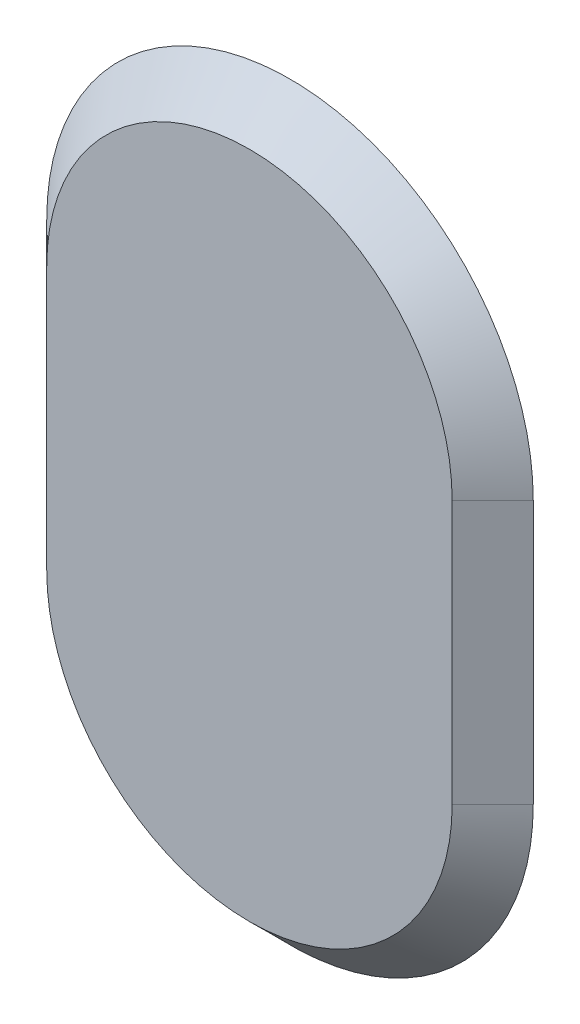
from build123d import *

# Parameters (mm, degrees)
SALIENTE_EXTRUIR1_DEPTH = 1
CHAFL_N1_SIZE           = 1


with BuildPart() as part:
    # Croquis1 → Saliente-Extruir1 (new body)
    with BuildSketch(Plane.XY):
        with BuildLine():
            Line((-6, -3.25), (-6, 3.25))
            ThreePointArc((-6, 3.25), (0, 9.25), (6, 3.25))
            Line((6, 3.25), (6, -3.25))
            ThreePointArc((6, -3.25), (0, -9.25), (-6, -3.25))
        make_face()
    extrude(amount=SALIENTE_EXTRUIR1_DEPTH)

    # Chaflán1
    chafl_n1_edges = [part.edges().sort_by_distance(p)[0] for p in [
        (0, -9.25, 1),
        (6, 0, 1),
        (-6, 0, 1),
        (0, 9.25, 1),
    ]]
    chamfer(chafl_n1_edges, length=CHAFL_N1_SIZE - 0.0001)  # a hair under: the kernel refuses the full size


solid = part.part
